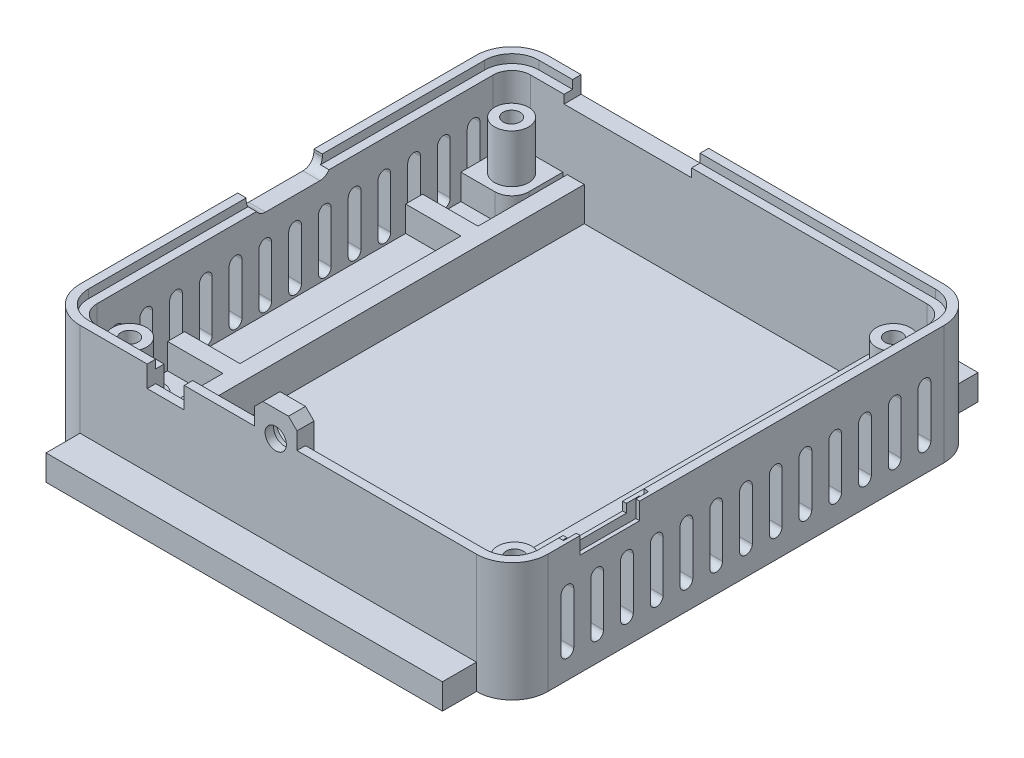
from build123d import *

# Parameters (mm, degrees)
BOSS_EXTRUDE1_DEPTH  = 14
BOSS_EXTRUDE2_DEPTH  = 13
BOSS_EXTRUDE4_DEPTH  = 2
SKETCH4_W            = 15
SKETCH4_H            = 2
CUT_EXTRUDE1_DEPTH   = 2
CUT_EXTRUDE3_DEPTH   = 2
SKETCH7_R            = 1.25
CUT_EXTRUDE4_DEPTH   = 2
BOSS_EXTRUDE6_DEPTH  = 3
SKETCH2_7_R          = 1
BOSS_EXTRUDE9_DEPTH  = 5
SKETCH11_R           = 2
SKETCH11_R_2         = 1
BOSS_EXTRUDE10_DEPTH = 5.68
BOSS_EXTRUDE11_DEPTH = 2
SKETCH15_W           = 0.750971698
SKETCH15_H           = 1
BOSS_EXTRUDE13_DEPTH = 1
SKETCH8_R            = 2
CUT_EXTRUDE5_DEPTH   = 1
SKETCH16_W           = 34
SKETCH16_H           = 51
CUT_EXTRUDE6_DEPTH   = 1
SKETCH17_R           = 2
CUT_EXTRUDE7_DEPTH   = 3
CUT_EXTRUDE9_DEPTH   = 2
CUT_EXTRUDE10_START  = -2
CUT_EXTRUDE10_DEPTH  = 2
SKETCH21_W           = 4.36
SKETCH21_H           = 2.5
CUT_EXTRUDE11_DEPTH  = 2
SKETCH23_W           = 4.36
SKETCH23_H           = 6.5
CUT_EXTRUDE12_DEPTH  = 1
SKETCH24_W           = 7
SKETCH24_H           = 2
CUT_EXTRUDE13_DEPTH  = 2
SKETCH26_W           = 1.1
SKETCH26_H           = 10
CUT_EXTRUDE14_DEPTH  = 4
CHAMFER1_SIZE        = 1
SKETCH28_W           = 46.63
SKETCH28_H           = 3
BOSS_EXTRUDE14_DEPTH = 4
SKETCH29_W           = 46.63
SKETCH29_H           = 3
BOSS_EXTRUDE15_DEPTH = 4


with BuildPart() as part:
    # Sketch2 → Boss-Extrude1 (new body)
    with BuildSketch(Plane(origin=(0, 0, 0), x_dir=(1, 0, 0), z_dir=(0, 1, 0))):
        with BuildLine():
            ThreePointArc((-23.315, 27.5), (-26.284848481, 26.269848481), (-27.515, 23.3))
            Line((-27.515, 23.3), (-27.515, -23.3))
            ThreePointArc((-27.515, -23.3), (-26.284848481, -26.269848481), (-23.315, -27.5))
            Line((-23.315, -27.5), (23.315, -27.5))
            ThreePointArc((23.315, -27.5), (26.284848481, -26.269848481), (27.515, -23.3))
            Line((27.515, -23.3), (27.515, 23.3))
            ThreePointArc((27.515, 23.3), (26.284848481, 26.269848481), (23.315, 27.5))
            Line((23.315, 27.5), (-23.315, 27.5))
        make_face()
        with BuildLine():
            Line((-26.515, -23.3), (-26.515, 23.3))
            ThreePointArc((-26.515, 23.3), (-25.5777417, 25.5627417), (-23.315, 26.5))
            Line((-23.315, 26.5), (23.315, 26.5))
            ThreePointArc((23.315, 26.5), (25.5777417, 25.5627417), (26.515, 23.3))
            Line((26.515, 23.3), (26.515, -23.3))
            ThreePointArc((26.515, -23.3), (25.5777417, -25.5627417), (23.315, -26.5))
            Line((23.315, -26.5), (-23.315, -26.5))
            ThreePointArc((-23.315, -26.5), (-25.5777417, -25.5627417), (-26.515, -23.3))
        make_face(mode=Mode.SUBTRACT)
    extrude(amount=BOSS_EXTRUDE1_DEPTH)

    # Sketch2<3> → Boss-Extrude2 (add)
    with BuildSketch(Plane(origin=(0, 0, 0), x_dir=(1, 0, 0), z_dir=(0, 1, 0))):
        with BuildLine():
            ThreePointArc((-23.315, 26.5), (-25.5777417, 25.5627417), (-26.515, 23.3))
            Line((-26.515, 23.3), (-26.515, -23.3))
            ThreePointArc((-26.515, -23.3), (-25.5777417, -25.5627417), (-23.315, -26.5))
            Line((-23.315, -26.5), (23.315, -26.5))
            ThreePointArc((23.315, -26.5), (25.5777417, -25.5627417), (26.515, -23.3))
            Line((26.515, -23.3), (26.515, 23.3))
            ThreePointArc((26.515, 23.3), (25.5777417, 25.5627417), (23.315, 26.5))
            Line((23.315, 26.5), (-23.315, 26.5))
        make_face()
        with BuildLine():
            ThreePointArc((-25.515, 23.3), (-24.870634919, 24.855634919), (-23.315, 25.5))
            Line((-23.315, 25.5), (-19.515, 25.5))
            Line((-19.515, 25.5), (19.515, 25.5))
            Line((19.515, 25.5), (23.315, 25.5))
            ThreePointArc((23.315, 25.5), (24.870634919, 24.855634919), (25.515, 23.3))
            Line((25.515, 23.3), (25.515, 19.5))
            Line((25.515, 19.5), (25.515, -19.5))
            Line((25.515, -19.5), (25.515, -23.3))
            ThreePointArc((25.515, -23.3), (24.870634919, -24.855634919), (23.315, -25.5))
            Line((23.315, -25.5), (19.515, -25.5))
            Line((19.515, -25.5), (-19.515, -25.5))
            Line((-19.515, -25.5), (-23.315, -25.5))
            ThreePointArc((-23.315, -25.5), (-24.870634919, -24.855634919), (-25.515, -23.3))
            Line((-25.515, -23.3), (-25.515, -19.5))
            Line((-25.515, -19.5), (-25.515, 19.5))
            Line((-25.515, 19.5), (-25.515, 23.3))
        make_face(mode=Mode.SUBTRACT)
    extrude(amount=BOSS_EXTRUDE2_DEPTH)

    # Sketch2<5> → Boss-Extrude4 (add)
    with BuildSketch(Plane(origin=(0, 0, 0), x_dir=(1, 0, 0), z_dir=(0, 1, 0))):
        with BuildLine():
            Line((19.515, 25.5), (-19.515, 25.5))
            Line((-19.515, 25.5), (-19.515, 21.5))
            ThreePointArc((-19.515, 21.5), (-20.100786438, 20.085786438), (-21.515, 19.5))
            Line((-21.515, 19.5), (-25.515, 19.5))
            Line((-25.515, 19.5), (-25.515, -19.5))
            Line((-25.515, -19.5), (-21.515, -19.5))
            ThreePointArc((-21.515, -19.5), (-20.100786438, -20.085786438), (-19.515, -21.5))
            Line((-19.515, -21.5), (-19.515, -25.5))
            Line((-19.515, -25.5), (19.515, -25.5))
            Line((19.515, -25.5), (19.515, -21.5))
            ThreePointArc((19.515, -21.5), (20.100786438, -20.085786438), (21.515, -19.5))
            Line((21.515, -19.5), (25.515, -19.5))
            Line((25.515, -19.5), (25.515, 19.5))
            Line((25.515, 19.5), (21.515, 19.5))
            ThreePointArc((21.515, 19.5), (20.100786438, 20.085786438), (19.515, 21.5))
            Line((19.515, 21.5), (19.515, 25.5))
        make_face()
    extrude(amount=BOSS_EXTRUDE4_DEPTH)

    # Sketch4 → Cut-Extrude1 (cut)
    with BuildSketch(Plane(origin=(0, 0, -27.5), x_dir=(-1, 0, 0), z_dir=(0, 0, -1))):
        with Locations((11.875, 13)):
            Rectangle(SKETCH4_W, SKETCH4_H)
    extrude(amount=-CUT_EXTRUDE1_DEPTH, mode=Mode.SUBTRACT)

    # Sketch6 → Cut-Extrude3 (cut)
    with BuildSketch(Plane.ZY.offset(27.515)):
        with BuildLine():
            Line((-4.2, 14), (4.75, 14))
            Line((4.75, 14), (4.75, 13.7))
            ThreePointArc((4.75, 13.7), (4.37509668, 12.79490332), (3.47, 12.42))
            Line((3.47, 12.42), (-2.92, 12.42))
            ThreePointArc((-2.92, 12.42), (-3.82509668, 12.79490332), (-4.2, 13.7))
            Line((-4.2, 13.7), (-4.2, 14))
        make_face()
    extrude(amount=-CUT_EXTRUDE3_DEPTH, mode=Mode.SUBTRACT)

    # Sketch7 → Cut-Extrude4 (cut)
    with BuildSketch(Plane.XY.offset(27.5)):
        with Locations((-0.29, 13.97)):
            Circle(SKETCH7_R)
    extrude(amount=-CUT_EXTRUDE4_DEPTH, mode=Mode.SUBTRACT)

    # Sketch9 → Boss-Extrude6 (add)
    with BuildSketch(Plane(origin=(0, 2, 0), x_dir=(1, 0, 0), z_dir=(0, 1, 0))):
        Polygon((-17, 25.5), (-17, -25.5), (-19, -25.5), (-19, -15), (-25.515, -15), (-25.515, -13), (-19, -13), (-19, 13), (-25.515, 13), (-25.515, 15), (-19, 15), (-19, 25.5), align=None)
        Polygon((17, 25.5), (17, -25.5), (19, -25.5), (19, -15), (25.515, -15), (25.515, -13), (19, -13), (19, 13), (25.515, 13), (25.515, 15), (19, 15), (19, 25.5), align=None)
    extrude(amount=BOSS_EXTRUDE6_DEPTH)

    # Sketch2<7> → Boss-Extrude9 (add)
    # profile 1 of 4: a face of its own
    with BuildSketch(Plane(origin=(0, 0, 0), x_dir=(1, 0, 0), z_dir=(0, 1, 0))):
        with BuildLine():
            Line((-19.515, 25.5), (-23.315, 25.5))
            ThreePointArc((-23.315, 25.5), (-24.870634919, 24.855634919), (-25.515, 23.3))
            Line((-25.515, 23.3), (-25.515, 19.5))
            Line((-25.515, 19.5), (-21.515, 19.5))
            ThreePointArc((-21.515, 19.5), (-20.100786438, 20.085786438), (-19.515, 21.5))
            Line((-19.515, 21.5), (-19.515, 25.5))
        make_face()
        with Locations((-22.455, 22.41)):
            Circle(SKETCH2_7_R, mode=Mode.SUBTRACT)
    # profile 2 of 4: a face of its own
    with BuildSketch(Plane(origin=(0, 0, 0), x_dir=(1, 0, 0), z_dir=(0, 1, 0))):
        with BuildLine():
            Line((23.315, 25.5), (19.515, 25.5))
            Line((19.515, 25.5), (19.515, 21.5))
            ThreePointArc((19.515, 21.5), (20.100786438, 20.085786438), (21.515, 19.5))
            Line((21.515, 19.5), (25.515, 19.5))
            Line((25.515, 19.5), (25.515, 23.3))
            ThreePointArc((25.515, 23.3), (24.870634919, 24.855634919), (23.315, 25.5))
        make_face()
        with Locations((22.445, 22.42)):
            Circle(SKETCH2_7_R, mode=Mode.SUBTRACT)
    # profile 3 of 4: a face of its own
    with BuildSketch(Plane(origin=(0, 0, 0), x_dir=(1, 0, 0), z_dir=(0, 1, 0))):
        with BuildLine():
            Line((-21.515, -19.5), (-25.515, -19.5))
            Line((-25.515, -19.5), (-25.515, -23.3))
            ThreePointArc((-25.515, -23.3), (-24.870634919, -24.855634919), (-23.315, -25.5))
            Line((-23.315, -25.5), (-19.515, -25.5))
            Line((-19.515, -25.5), (-19.515, -21.5))
            ThreePointArc((-19.515, -21.5), (-20.100786438, -20.085786438), (-21.515, -19.5))
        make_face()
        with Locations((-22.495, -22.49)):
            Circle(SKETCH2_7_R, mode=Mode.SUBTRACT)
    # profile 4 of 4: a face of its own
    with BuildSketch(Plane(origin=(0, 0, 0), x_dir=(1, 0, 0), z_dir=(0, 1, 0))):
        with BuildLine():
            Line((25.515, -23.3), (25.515, -19.5))
            Line((25.515, -19.5), (21.515, -19.5))
            ThreePointArc((21.515, -19.5), (20.100786438, -20.085786438), (19.515, -21.5))
            Line((19.515, -21.5), (19.515, -25.5))
            Line((19.515, -25.5), (23.315, -25.5))
            ThreePointArc((23.315, -25.5), (24.870634919, -24.855634919), (25.515, -23.3))
        make_face()
        with Locations((22.425, -22.11)):
            Circle(SKETCH2_7_R, mode=Mode.SUBTRACT)
    extrude(amount=BOSS_EXTRUDE9_DEPTH)

    # Sketch11 → Boss-Extrude10 (add)
    # profile 1 of 4: a face of its own
    with BuildSketch(Plane(origin=(0, 5, 0), x_dir=(1, 0, 0), z_dir=(0, 1, 0))):
        with Locations((-22.455, 22.41)):
            Circle(SKETCH11_R)
        with Locations((-22.455, 22.41)):
            Circle(SKETCH11_R_2, mode=Mode.SUBTRACT)
    # profile 2 of 4: a face of its own
    with BuildSketch(Plane(origin=(0, 5, 0), x_dir=(1, 0, 0), z_dir=(0, 1, 0))):
        with Locations((22.445, 22.42)):
            Circle(SKETCH11_R)
        with Locations((22.445, 22.42)):
            Circle(SKETCH11_R_2, mode=Mode.SUBTRACT)
    # profile 3 of 4: a face of its own
    with BuildSketch(Plane(origin=(0, 5, 0), x_dir=(1, 0, 0), z_dir=(0, 1, 0))):
        with Locations((-22.495, -22.49)):
            Circle(SKETCH11_R)
        with Locations((-22.495, -22.49)):
            Circle(SKETCH11_R_2, mode=Mode.SUBTRACT)
    # profile 4 of 4: a face of its own
    with BuildSketch(Plane(origin=(0, 5, 0), x_dir=(1, 0, 0), z_dir=(0, 1, 0))):
        with Locations((22.425, -22.11)):
            Circle(SKETCH11_R)
        with Locations((22.425, -22.11)):
            Circle(SKETCH11_R_2, mode=Mode.SUBTRACT)
    extrude(amount=BOSS_EXTRUDE10_DEPTH)

    # Sketch13 → Boss-Extrude11 (add)
    with BuildSketch(Plane.XY.offset(27.5)):
        with BuildLine():
            Line((-2.79, 17), (2.21, 17))
            Line((2.21, 17), (2.21, 14))
            Line((2.21, 14), (0.959639948, 14))
            ThreePointArc((0.959639948, 14), (-0.29, 15.22), (-1.539639948, 14))
            Line((-1.539639948, 14), (-2.79, 14))
            Line((-2.79, 14), (-2.79, 17))
        make_face()
    extrude(amount=-BOSS_EXTRUDE11_DEPTH)

    # Sketch15 → Boss-Extrude13 (add)
    with BuildSketch(Plane(origin=(0, 0, 26.5), x_dir=(-1, 0, 0), z_dir=(0, 0, -1))):
        with Locations((-1.834514151, 13.5)):
            Rectangle(SKETCH15_W, SKETCH15_H)
        with Locations((2.414514151, 13.5)):
            Rectangle(SKETCH15_W, SKETCH15_H)
    extrude(amount=BOSS_EXTRUDE13_DEPTH)

    # Sketch8 → Cut-Extrude5 (cut)
    with BuildSketch(Plane(origin=(0, 0, 25.5), x_dir=(-1, 0, 0), z_dir=(0, 0, -1))):
        with Locations((0.29, 13.97)):
            Circle(SKETCH8_R)
    extrude(amount=-CUT_EXTRUDE5_DEPTH, mode=Mode.SUBTRACT)

    # Sketch16 → Cut-Extrude6 (cut)
    with BuildSketch(Plane(origin=(0, 2, 0), x_dir=(1, 0, 0), z_dir=(0, 1, 0))):
        Rectangle(SKETCH16_W, SKETCH16_H)
    extrude(amount=-CUT_EXTRUDE6_DEPTH, mode=Mode.SUBTRACT)

    # Sketch17 → Cut-Extrude7 (cut)
    with BuildSketch(Plane.XZ):
        with Locations((-22.495, 22.49)):
            Circle(SKETCH17_R)
        with Locations((22.425, 22.11)):
            Circle(SKETCH17_R)
        with Locations((-22.455, -22.41)):
            Circle(SKETCH17_R)
        with Locations((22.445, -22.42)):
            Circle(SKETCH17_R)
    extrude(amount=-CUT_EXTRUDE7_DEPTH, mode=Mode.SUBTRACT)

    # Sketch19 → Cut-Extrude9 (cut)
    with BuildSketch(Plane(origin=(27.515, 0, 0), x_dir=(0, 0, -1), z_dir=(1, 0, 0))):
        with BuildLine():
            Line((-21.75, 9), (-21.75, 3))
            ThreePointArc((-21.75, 3), (-21, 2.25), (-20.25, 3))
            Line((-20.25, 3), (-20.25, 9))
            ThreePointArc((-20.25, 9), (-21, 9.75), (-21.75, 9))
        make_face()
        with BuildLine():
            Line((-18.25, 9), (-18.25, 3))
            ThreePointArc((-18.25, 3), (-17.5, 2.25), (-16.75, 3))
            Line((-16.75, 3), (-16.75, 9))
            ThreePointArc((-16.75, 9), (-17.5, 9.75), (-18.25, 9))
        make_face()
        with BuildLine():
            Line((-14.75, 9), (-14.75, 3))
            ThreePointArc((-14.75, 3), (-14, 2.25), (-13.25, 3))
            Line((-13.25, 3), (-13.25, 9))
            ThreePointArc((-13.25, 9), (-14, 9.75), (-14.75, 9))
        make_face()
        with BuildLine():
            Line((-11.25, 9), (-11.25, 3))
            ThreePointArc((-11.25, 3), (-10.5, 2.25), (-9.75, 3))
            Line((-9.75, 3), (-9.75, 9))
            ThreePointArc((-9.75, 9), (-10.5, 9.75), (-11.25, 9))
        make_face()
        with BuildLine():
            Line((-7.75, 9), (-7.75, 3))
            ThreePointArc((-7.75, 3), (-7, 2.25), (-6.25, 3))
            Line((-6.25, 3), (-6.25, 9))
            ThreePointArc((-6.25, 9), (-7, 9.75), (-7.75, 9))
        make_face()
        with BuildLine():
            Line((-4.25, 9), (-4.25, 3))
            ThreePointArc((-4.25, 3), (-3.5, 2.25), (-2.75, 3))
            Line((-2.75, 3), (-2.75, 9))
            ThreePointArc((-2.75, 9), (-3.5, 9.75), (-4.25, 9))
        make_face()
        with BuildLine():
            Line((-0.75, 9), (-0.75, 3))
            ThreePointArc((-0.75, 3), (0, 2.25), (0.75, 3))
            Line((0.75, 3), (0.75, 9))
            ThreePointArc((0.75, 9), (0, 9.75), (-0.75, 9))
        make_face()
        with BuildLine():
            Line((2.75, 9), (2.75, 3))
            ThreePointArc((2.75, 3), (3.5, 2.25), (4.25, 3))
            Line((4.25, 3), (4.25, 9))
            ThreePointArc((4.25, 9), (3.5, 9.75), (2.75, 9))
        make_face()
        with BuildLine():
            Line((6.25, 9), (6.25, 3))
            ThreePointArc((6.25, 3), (7, 2.25), (7.75, 3))
            Line((7.75, 3), (7.75, 9))
            ThreePointArc((7.75, 9), (7, 9.75), (6.25, 9))
        make_face()
        with BuildLine():
            Line((9.75, 9), (9.75, 3))
            ThreePointArc((9.75, 3), (10.5, 2.25), (11.25, 3))
            Line((11.25, 3), (11.25, 9))
            ThreePointArc((11.25, 9), (10.5, 9.75), (9.75, 9))
        make_face()
        with BuildLine():
            Line((13.25, 9), (13.25, 3))
            ThreePointArc((13.25, 3), (14, 2.25), (14.75, 3))
            Line((14.75, 3), (14.75, 9))
            ThreePointArc((14.75, 9), (14, 9.75), (13.25, 9))
        make_face()
        with BuildLine():
            Line((16.75, 9), (16.75, 3))
            ThreePointArc((16.75, 3), (17.5, 2.25), (18.25, 3))
            Line((18.25, 3), (18.25, 9))
            ThreePointArc((18.25, 9), (17.5, 9.75), (16.75, 9))
        make_face()
        with BuildLine():
            Line((20.25, 9), (20.25, 3))
            ThreePointArc((20.25, 3), (21, 2.25), (21.75, 3))
            Line((21.75, 3), (21.75, 9))
            ThreePointArc((21.75, 9), (21, 9.75), (20.25, 9))
        make_face()
    extrude(amount=-CUT_EXTRUDE9_DEPTH, mode=Mode.SUBTRACT)

    # Sketch20 → Cut-Extrude10 (cut)
    with BuildSketch(Plane.ZY.offset(27.515).offset(CUT_EXTRUDE10_START)):
        with BuildLine():
            Line((-21.75, 9), (-21.75, 3))
            ThreePointArc((-21.75, 3), (-21, 2.25), (-20.25, 3))
            Line((-20.25, 3), (-20.25, 9))
            ThreePointArc((-20.25, 9), (-21, 9.75), (-21.75, 9))
        make_face()
        with BuildLine():
            Line((-18.25, 9), (-18.25, 3))
            ThreePointArc((-18.25, 3), (-17.5, 2.25), (-16.75, 3))
            Line((-16.75, 3), (-16.75, 9))
            ThreePointArc((-16.75, 9), (-17.5, 9.75), (-18.25, 9))
        make_face()
        with BuildLine():
            Line((-14.75, 9), (-14.75, 3))
            ThreePointArc((-14.75, 3), (-14, 2.25), (-13.25, 3))
            Line((-13.25, 3), (-13.25, 9))
            ThreePointArc((-13.25, 9), (-14, 9.75), (-14.75, 9))
        make_face()
        with BuildLine():
            Line((-11.25, 9), (-11.25, 3))
            ThreePointArc((-11.25, 3), (-10.5, 2.25), (-9.75, 3))
            Line((-9.75, 3), (-9.75, 9))
            ThreePointArc((-9.75, 9), (-10.5, 9.75), (-11.25, 9))
        make_face()
        with BuildLine():
            Line((-7.75, 9), (-7.75, 3))
            ThreePointArc((-7.75, 3), (-7, 2.25), (-6.25, 3))
            Line((-6.25, 3), (-6.25, 9))
            ThreePointArc((-6.25, 9), (-7, 9.75), (-7.75, 9))
        make_face()
        with BuildLine():
            Line((-4.25, 9), (-4.25, 3))
            ThreePointArc((-4.25, 3), (-3.5, 2.25), (-2.75, 3))
            Line((-2.75, 3), (-2.75, 9))
            ThreePointArc((-2.75, 9), (-3.5, 9.75), (-4.25, 9))
        make_face()
        with BuildLine():
            Line((-0.75, 9), (-0.75, 3))
            ThreePointArc((-0.75, 3), (0, 2.25), (0.75, 3))
            Line((0.75, 3), (0.75, 9))
            ThreePointArc((0.75, 9), (0, 9.75), (-0.75, 9))
        make_face()
        with BuildLine():
            Line((2.75, 9), (2.75, 3))
            ThreePointArc((2.75, 3), (3.5, 2.25), (4.25, 3))
            Line((4.25, 3), (4.25, 9))
            ThreePointArc((4.25, 9), (3.5, 9.75), (2.75, 9))
        make_face()
        with BuildLine():
            Line((6.25, 9), (6.25, 3))
            ThreePointArc((6.25, 3), (7, 2.25), (7.75, 3))
            Line((7.75, 3), (7.75, 9))
            ThreePointArc((7.75, 9), (7, 9.75), (6.25, 9))
        make_face()
        with BuildLine():
            Line((9.75, 9), (9.75, 3))
            ThreePointArc((9.75, 3), (10.5, 2.25), (11.25, 3))
            Line((11.25, 3), (11.25, 9))
            ThreePointArc((11.25, 9), (10.5, 9.75), (9.75, 9))
        make_face()
        with BuildLine():
            Line((13.25, 9), (13.25, 3))
            ThreePointArc((13.25, 3), (14, 2.25), (14.75, 3))
            Line((14.75, 3), (14.75, 9))
            ThreePointArc((14.75, 9), (14, 9.75), (13.25, 9))
        make_face()
        with BuildLine():
            Line((16.75, 9), (16.75, 3))
            ThreePointArc((16.75, 3), (17.5, 2.25), (18.25, 3))
            Line((18.25, 3), (18.25, 9))
            ThreePointArc((18.25, 9), (17.5, 9.75), (16.75, 9))
        make_face()
        with BuildLine():
            Line((20.25, 9), (20.25, 3))
            ThreePointArc((20.25, 3), (21, 2.25), (21.75, 3))
            Line((21.75, 3), (21.75, 9))
            ThreePointArc((21.75, 9), (21, 9.75), (20.25, 9))
        make_face()
    extrude(amount=CUT_EXTRUDE10_DEPTH, mode=Mode.SUBTRACT)

    # Sketch21 → Cut-Extrude11 (cut)
    with BuildSketch(Plane.XY.offset(27.5)):
        with Locations((-13.235, 12.75)):
            Rectangle(SKETCH21_W, SKETCH21_H)
    extrude(amount=-CUT_EXTRUDE11_DEPTH, mode=Mode.SUBTRACT)

    # Sketch23 → Cut-Extrude12 (cut)
    with BuildSketch(Plane(origin=(0, 0, 25.5), x_dir=(-1, 0, 0), z_dir=(0, 0, -1))):
        with Locations((13.235, 8.25)):
            Rectangle(SKETCH23_W, SKETCH23_H)
    extrude(amount=-CUT_EXTRUDE12_DEPTH, mode=Mode.SUBTRACT)

    # Sketch24 → Cut-Extrude13 (cut)
    with BuildSketch(Plane(origin=(27.515, 0, 0), x_dir=(0, 0, -1), z_dir=(1, 0, 0))):
        with Locations((-16, 13)):
            Rectangle(SKETCH24_W, SKETCH24_H)
    extrude(amount=-CUT_EXTRUDE13_DEPTH, mode=Mode.SUBTRACT)

    # Sketch26 → Cut-Extrude14 (cut)
    with BuildSketch(Plane(origin=(0, 14, 0), x_dir=(1, 0, 0), z_dir=(0, 1, 0))):
        with Locations((26.515, -16)):
            Rectangle(SKETCH26_W, SKETCH26_H)
    extrude(amount=-CUT_EXTRUDE14_DEPTH, mode=Mode.SUBTRACT)

    # Chamfer1
    chamfer1_edges = [part.edges().sort_by_distance(p)[0] for p in [
        (-2.79, 17, 26.5),
        (2.21, 17, 26.5),
    ]]
    chamfer(chamfer1_edges, length=CHAMFER1_SIZE)

    # Sketch28 → Boss-Extrude14 (add)
    with BuildSketch(Plane.XY.offset(27.5)):
        with Locations((0, 1.5)):
            Rectangle(SKETCH28_W, SKETCH28_H)
    extrude(amount=BOSS_EXTRUDE14_DEPTH)

    # Sketch29 → Boss-Extrude15 (add)
    with BuildSketch(Plane(origin=(0, 0, -27.5), x_dir=(-1, 0, 0), z_dir=(0, 0, -1))):
        with Locations((0, 1.5)):
            Rectangle(SKETCH29_W, SKETCH29_H)
    extrude(amount=BOSS_EXTRUDE15_DEPTH)


solid = part.part
